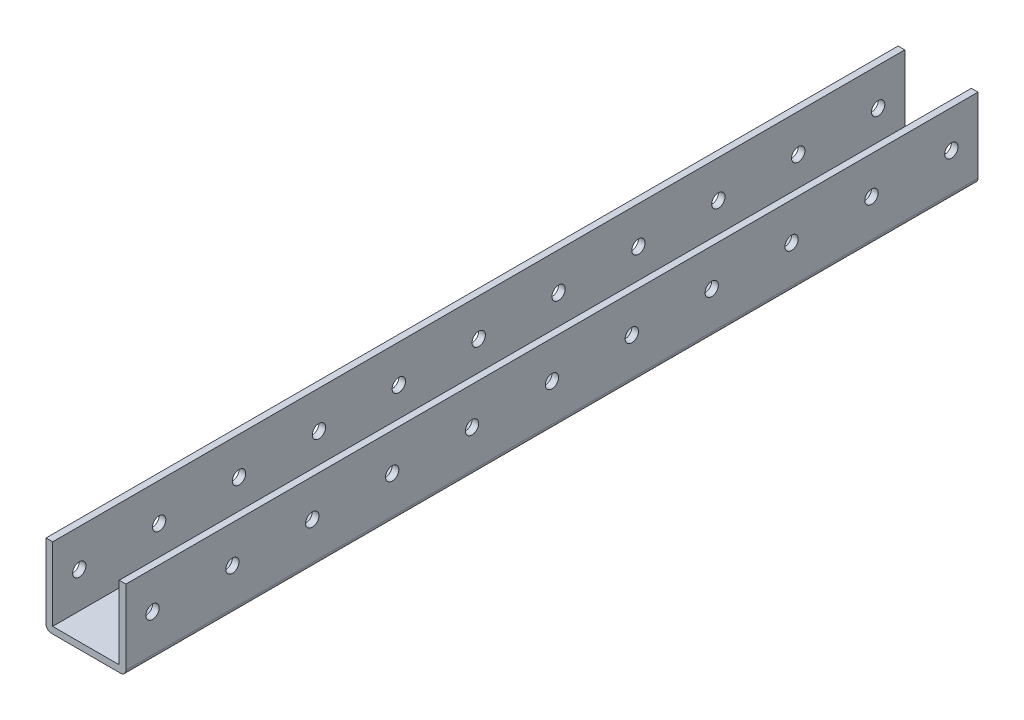
from build123d import *

# Parameters (mm, degrees)
SKETCH2_W           = 38.1
SKETCH2_H           = 406.4
BOSS_EXTRUDE1_DEPTH = 38.1
SKETCH3_W           = 31.75
SKETCH3_H           = 34.925
CUT_EXTRUDE1_DEPTH  = 406.4
FILLET1_R           = 2.54
SKETCH4_R           = 3.175
CUT_EXTRUDE2_DEPTH  = 50.8


with BuildPart() as part:
    # Sketch2 → Boss-Extrude1 (new body)
    with BuildSketch(Plane(origin=(0, 0, 0), x_dir=(1, 0, 0), z_dir=(0, 1, 0))):
        Rectangle(SKETCH2_W, SKETCH2_H)
    extrude(amount=BOSS_EXTRUDE1_DEPTH)

    # Sketch3 → Cut-Extrude1 (cut)
    with BuildSketch(Plane.XY.offset(203.2)):
        with Locations((0, 20.6375)):
            Rectangle(SKETCH3_W, SKETCH3_H)
    extrude(amount=-CUT_EXTRUDE1_DEPTH, mode=Mode.SUBTRACT)

    # Fillet1
    fillet1_edges = [part.edges().sort_by_distance(p)[0] for p in [
        (-19.05, 0, 0),
        (19.05, 0, 0),
    ]]
    fillet(fillet1_edges, radius=FILLET1_R)

    # Sketch4 → Cut-Extrude2 (cut)
    with BuildSketch(Plane(origin=(19.05, 0, 0), x_dir=(0, 0, -1), z_dir=(1, 0, 0))):
        with Locations((-190.5, 20.32)):
            Circle(SKETCH4_R)
        with Locations((-152.4, 20.32)):
            Circle(SKETCH4_R)
        with Locations((-114.3, 20.32)):
            Circle(SKETCH4_R)
        with Locations((-76.2, 20.32)):
            Circle(SKETCH4_R)
        with Locations((-38.1, 20.32)):
            Circle(SKETCH4_R)
        with Locations((0, 20.32)):
            Circle(SKETCH4_R)
        with Locations((38.1, 20.32)):
            Circle(SKETCH4_R)
        with Locations((76.2, 20.32)):
            Circle(SKETCH4_R)
        with Locations((114.3, 20.32)):
            Circle(SKETCH4_R)
        with Locations((152.4, 20.32)):
            Circle(SKETCH4_R)
        with Locations((190.5, 20.32)):
            Circle(SKETCH4_R)
    extrude(amount=-CUT_EXTRUDE2_DEPTH, mode=Mode.SUBTRACT)


solid = part.part
